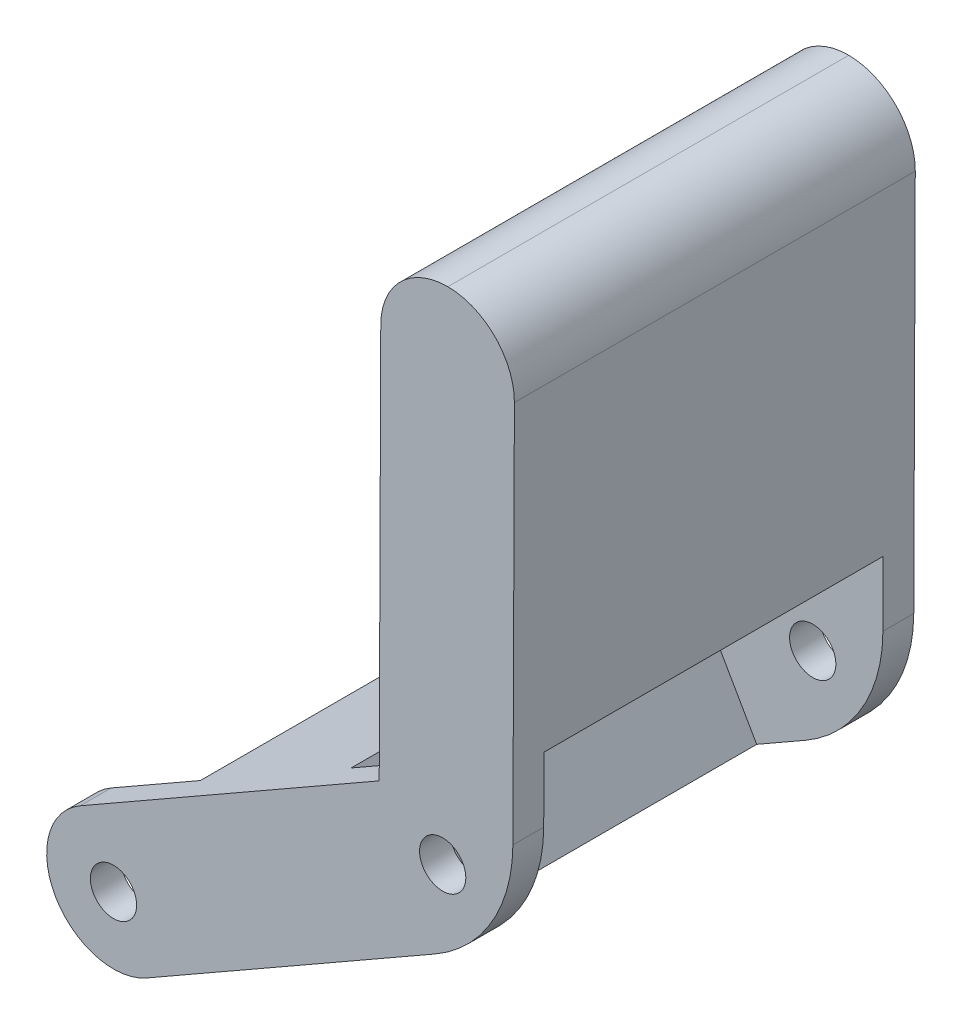
from build123d import *

# Parameters (mm, degrees)
SKETCH1_R           = 2.25
BOSS_EXTRUDE1_DEPTH = 39
SKETCH2_W           = 55
SKETCH2_H           = 33
CUT_EXTRUDE1_DEPTH  = 81.036070374
FILLET1_R           = 6.5
FILLET2_R           = 15
BOSS_EXTRUDE2_REACH = 76.379
FILLET3_R           = 6.5


with BuildPart() as part:
    # Sketch1 → Boss-Extrude1 (new body)
    with BuildSketch(Plane.XY):
        Polygon((7.10189894, 0.127356388), (7.308909237, 52.632501802), (-5.690989724, 52.683756073), (-5.868408354, 7.684105823), (-40.588007992, -12.179161807), (-34.132446013, -23.46303169), align=None)
        with Locations((-31.718292061, -14.593315758)):
            Circle(SKETCH1_R, mode=Mode.SUBTRACT)
        with Locations((0.306965546, 3.728504465)):
            Circle(SKETCH1_R, mode=Mode.SUBTRACT)
    extrude(amount=BOSS_EXTRUDE1_DEPTH)

    # Sketch2 → Cut-Extrude1 (cut, through all)
    with BuildSketch(Plane(origin=(1.696387072, -2.965165705, 0), x_dir=(0.8679899909572786, 0.49658169075992264, 0), z_dir=(0.4965816907599227, -0.8679899909572787, 0))):
        with Locations((-13.777933453, 19.5)):
            Rectangle(SKETCH2_W, SKETCH2_H)
    extrude(amount=-CUT_EXTRUDE1_DEPTH, mode=Mode.SUBTRACT)

    # Fillet1
    fillet1_edges = [part.edges().sort_by_distance(p)[0] for p in [
        (-34.132446013, -23.46303169, 1.5),
        (-40.588007992, -12.179161807, 1.5),
        (-34.132446013, -23.46303169, 37.5),
        (-40.588007992, -12.179161807, 37.5),
    ]]
    fillet(fillet1_edges, radius=FILLET1_R - 0.0001)  # a hair under: the kernel refuses the full size

    # Fillet2
    fillet2_edges = [part.edges().sort_by_distance(p)[0] for p in [
        (7.10189894, 0.127356388, 37.5),
        (7.10189894, 0.127356388, 1.5),
    ]]
    fillet(fillet2_edges, radius=FILLET2_R)

    # Sketch3 → Boss-Extrude2 (add, up to next)
    with BuildSketch(Plane.XY.offset(3), mode=Mode.PRIVATE) as boss_extrude2_sk1:
        Polygon((-26.266173142, -3.98556391), (-19.810611162, -15.269433792), (-5.145153373, -6.879247384), (-11.600715353, 4.404622498), align=None)
    boss_extrude2_tool1 = extrude(boss_extrude2_sk1.sketch, amount=BOSS_EXTRUDE2_REACH, mode=Mode.PRIVATE) - part.part
    add(boss_extrude2_tool1.solids().sort_by_distance((-15.705663, -5.432406, 3))[0])

    # Fillet3
    fillet3_edges = [part.edges().sort_by_distance(p)[0] for p in [
        (7.308909237, 52.632501802, 19.5),
        (-5.690989724, 52.683756073, 19.5),
    ]]
    fillet(fillet3_edges, radius=FILLET3_R - 0.0001)  # a hair under: the kernel refuses the full size


solid = part.part
